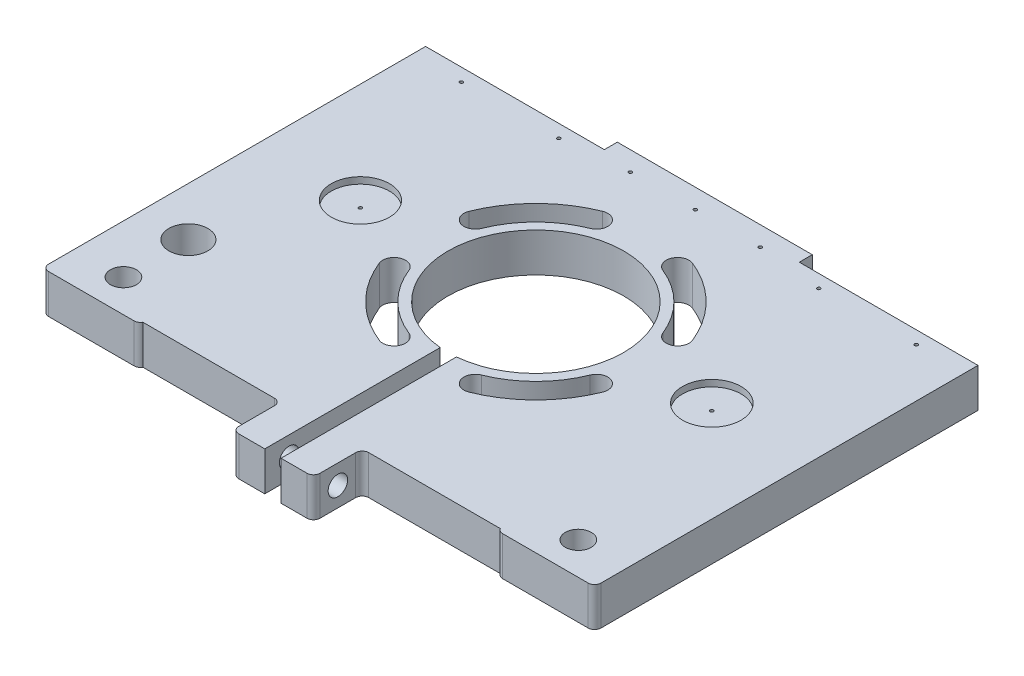
from build123d import *

# Parameters (mm, degrees)
SKETCH1_R           = 0.5
SKETCH1_R_2         = 6
SKETCH1_R_3         = 4
BOSS_EXTRUDE1_DEPTH = 12
SKETCH2_R           = 8.95
SKETCH2_R_2         = 9
CUT_EXTRUDE1_DEPTH  = 2
SKETCH3_R           = 0.5
CUT_EXTRUDE2_DEPTH  = 210.485083001
SKETCH4_R           = 3
CUT_EXTRUDE3_DEPTH  = 25
FILLET1_R           = 2


with BuildPart() as part:
    # Sketch1 → Boss-Extrude1 (new body)
    with BuildSketch(Plane(origin=(0, 0, 0), x_dir=(1, 0, 0), z_dir=(0, 1, 0))):
        with BuildLine():
            Line((55, 122), (55, 118))
            Line((55, 118), (0, 118))
            Line((0, 118), (0, 0))
            Line((0, 0), (30, 0))
            Line((30, 0), (30, 1))
            Line((30, 1), (72.5, 1))
            Line((72.5, 1), (72.5, -14))
            Line((72.5, -14), (82.5, -14))
            Line((82.5, -14), (82.5, 40))
            ThreePointArc((82.5, 40), (85, 93.984225439), (87.5, 40))
            Line((87.5, 40), (87.5, -14))
            Line((87.5, -14), (97.5, -14))
            Line((97.5, -14), (97.5, 1))
            Line((97.5, 1), (140, 1))
            Line((140, 1), (140, 0))
            Line((140, 0), (170, 0))
            Line((170, 0), (170, 118))
            Line((170, 118), (115, 118))
            Line((115, 118), (115, 122))
            Line((115, 122), (55, 122))
        make_face()
        with Locations(Location((65, 116, 0), (0, 0, 270))):
            Circle(SKETCH1_R, mode=Mode.SUBTRACT)
        with Locations(Location((105, 116, 0), (0, 0, 90))):
            Circle(SKETCH1_R, mode=Mode.SUBTRACT)
        with Locations(Location((45, 114, 0), (0, 0, 270))):
            Circle(SKETCH1_R, mode=Mode.SUBTRACT)
        with Locations(Location((15, 114, 0), (0, 0, 270))):
            Circle(SKETCH1_R, mode=Mode.SUBTRACT)
        with Locations(Location((155, 114, 0), (0, 0, 90))):
            Circle(SKETCH1_R, mode=Mode.SUBTRACT)
        with Locations(Location((125, 114, 0), (0, 0, 90))):
            Circle(SKETCH1_R, mode=Mode.SUBTRACT)
        with Locations(Location((15, 30, 0), (0, 0, 270))):
            Circle(SKETCH1_R_2, mode=Mode.SUBTRACT)
        with Locations(Location((155, 10, 0), (0, 0, 270))):
            Circle(SKETCH1_R_3, mode=Mode.SUBTRACT)
        with Locations(Location((15, 10, 0), (0, 0, 90))):
            Circle(SKETCH1_R_3, mode=Mode.SUBTRACT)
        with Locations(Location((85, 116, 0), (0, 0, 270))):
            Circle(SKETCH1_R, mode=Mode.SUBTRACT)
        with BuildLine():
            ThreePointArc((71.195976155, 101.316654464), (58.801693757, 93.132531682), (50.617570975, 80.738249284))
            ThreePointArc((50.617570975, 80.738249284), (52.561549872, 76.186222697), (57.113576458, 78.130201594))
            ThreePointArc((57.113576458, 78.130201594), (63.751441225, 88.182784214), (73.804023845, 94.820648981))
            ThreePointArc((73.804023845, 94.820648981), (75.748002742, 99.372675567), (71.195976155, 101.316654464))
        make_face(mode=Mode.SUBTRACT)
        with BuildLine():
            ThreePointArc((98.804023845, 101.316654464), (111.198306243, 93.132531682), (119.382429025, 80.738249284))
            ThreePointArc((119.382429025, 80.738249284), (117.438450128, 76.186222697), (112.886423542, 78.130201594))
            ThreePointArc((112.886423542, 78.130201594), (106.248558775, 88.182784214), (96.195976155, 94.820648981))
            ThreePointArc((96.195976155, 94.820648981), (94.251997258, 99.372675567), (98.804023845, 101.316654464))
        make_face(mode=Mode.SUBTRACT)
        with BuildLine():
            ThreePointArc((71.195976155, 32.551796414), (58.801693757, 40.735919196), (50.617570975, 53.130201594))
            ThreePointArc((50.617570975, 53.130201594), (52.561549872, 57.682228181), (57.113576458, 55.738249284))
            ThreePointArc((57.113576458, 55.738249284), (63.751441225, 45.685666664), (73.804023845, 39.047801898))
            ThreePointArc((73.804023845, 39.047801898), (75.748002742, 34.495775311), (71.195976155, 32.551796414))
        make_face(mode=Mode.SUBTRACT)
        with BuildLine():
            ThreePointArc((98.804023845, 32.551796414), (111.198306243, 40.735919196), (119.382429025, 53.130201594))
            ThreePointArc((119.382429025, 53.130201594), (117.438450128, 57.682228181), (112.886423542, 55.738249284))
            ThreePointArc((112.886423542, 55.738249284), (106.248558775, 45.685666664), (96.195976155, 39.047801898))
            ThreePointArc((96.195976155, 39.047801898), (94.251997258, 34.495775311), (98.804023845, 32.551796414))
        make_face(mode=Mode.SUBTRACT)
    extrude(amount=BOSS_EXTRUDE1_DEPTH)

    # Sketch2 → Cut-Extrude1 (cut)
    with BuildSketch(Plane(origin=(0, 12, 0), x_dir=(1, 0, 0), z_dir=(0, 1, 0))):
        with Locations(Location((31, 66.934225439, 0), (0, 0, 270))):
            Circle(SKETCH2_R)
        with Locations(Location((139.15, 66.934225439, 0), (0, 0, 270))):
            Circle(SKETCH2_R_2)
    extrude(amount=-CUT_EXTRUDE1_DEPTH, mode=Mode.SUBTRACT)

    # Sketch3 → Cut-Extrude2 (cut, through all)
    with BuildSketch(Plane(origin=(0, 10, 0), x_dir=(1, 0, 0), z_dir=(0, 1, 0))):
        with Locations(Location((31, 66.934225439, 0), (0, 0, 270))):
            Circle(SKETCH3_R)
        with Locations(Location((139.15, 66.934225439, 0), (0, 0, 270))):
            Circle(SKETCH3_R)
    extrude(amount=-CUT_EXTRUDE2_DEPTH, mode=Mode.SUBTRACT)

    # Sketch4 → Cut-Extrude3 (cut)
    with BuildSketch(Plane.ZY.offset(-72.5)):
        with Locations((6.5, 6)):
            Circle(SKETCH4_R)
    extrude(amount=-CUT_EXTRUDE3_DEPTH, mode=Mode.SUBTRACT)

    # Fillet1
    # the kernel refuses this fillet: 2 mm, written as the material it adds along each edge
    with BuildSketch(Plane(origin=(72.5, 0, -1), x_dir=(-1, 0, 0), z_dir=(0, 1, 0))) as fillet1_piece_1:
        with BuildLine():
            CenterArc((FILLET1_R, FILLET1_R), FILLET1_R, 180, 90)
            Line((0, FILLET1_R), (0, 0))
            Line((0, 0), (FILLET1_R, 0))
        make_face()
    extrude(amount=12)
    with BuildSketch(Plane(origin=(97.5, 0, -1), x_dir=(1, 0, 0), z_dir=(0, 1, 0))) as fillet1_piece_2:
        with BuildLine():
            CenterArc((FILLET1_R, -FILLET1_R), FILLET1_R, 90, 90)
            Line((0, -FILLET1_R), (0, 0))
            Line((0, 0), (FILLET1_R, 0))
        make_face()
    extrude(amount=12)
    # the kernel refuses this fillet: 2 mm, written as the material it takes off along each edge
    with BuildSketch(Plane(origin=(170, -5, 0), x_dir=(0, 0, -1), z_dir=(0, 1, 0)), Plane(origin=(97.5, -5, 14), x_dir=(0, 0, -1), z_dir=(0, 1, 0))) as fillet1_2_piece_1:
        with BuildLine():
            CenterArc((FILLET1_R, FILLET1_R), FILLET1_R, 180, 90)
            Line((0, FILLET1_R), (0, 0))
            Line((0, 0), (FILLET1_R, 0))
        make_face()
    extrude(amount=22, mode=Mode.SUBTRACT)
    with BuildSketch(Plane(origin=(140, -4.330127019, 0), x_dir=(1, 0, 0), z_dir=(0, 1, 0))) as fillet1_2_piece_2:
        with BuildLine():
            CenterArc((1.732050808, 2), FILLET1_R, 210, 60)
            Line((0, 1), (0, 0))
            Line((0, 0), (1.732050808, 0))
        make_face()
    extrude(amount=20.660254038, mode=Mode.SUBTRACT)
    with BuildSketch(Plane(origin=(72.5, -5, 14), x_dir=(0, 0, -1), z_dir=(0, 1, 0)), Plane(origin=(0, -5, 0), x_dir=(0, 0, -1), z_dir=(0, 1, 0))) as fillet1_2_piece_3:
        with BuildLine():
            CenterArc((FILLET1_R, -FILLET1_R), FILLET1_R, 90, 90)
            Line((0, -FILLET1_R), (0, 0))
            Line((0, 0), (FILLET1_R, 0))
        make_face()
    extrude(amount=22, mode=Mode.SUBTRACT)
    with BuildSketch(Plane(origin=(30, -4.330127019, 0), x_dir=(-1, 0, 0), z_dir=(0, 1, 0))) as fillet1_2_piece_4:
        with BuildLine():
            CenterArc((1.732050808, -2), FILLET1_R, 90, 60)
            Line((0, -1), (0, 0))
            Line((0, 0), (1.732050808, 0))
        make_face()
    extrude(amount=20.660254038, mode=Mode.SUBTRACT)


solid = part.part
